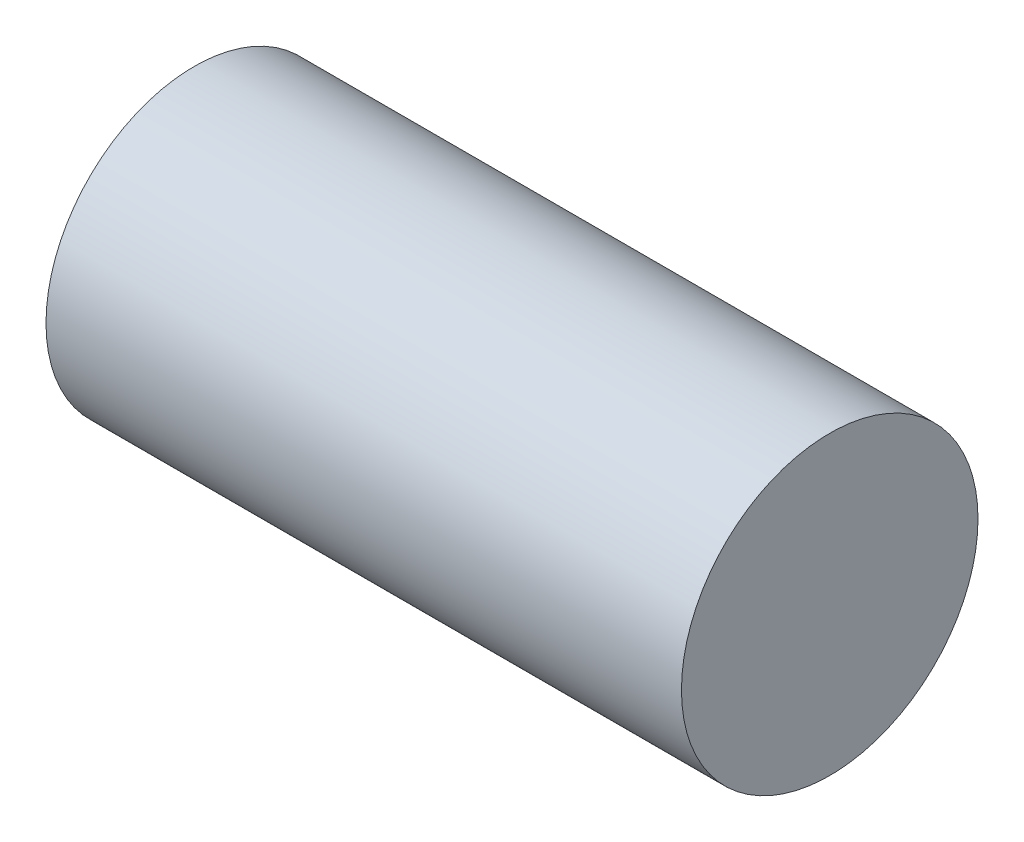
from build123d import *

# Parameters (mm, degrees)
SKETCH1_R           = 7
BOSS_EXTRUDE1_DEPTH = 30


with BuildPart() as part:
    # Sketch1 → Boss-Extrude1 (new body)
    with BuildSketch(Plane(origin=(0, 0, 0), x_dir=(0, 0, -1), z_dir=(1, 0, 0))):
        Circle(SKETCH1_R)
    extrude(amount=BOSS_EXTRUDE1_DEPTH)


solid = part.part
